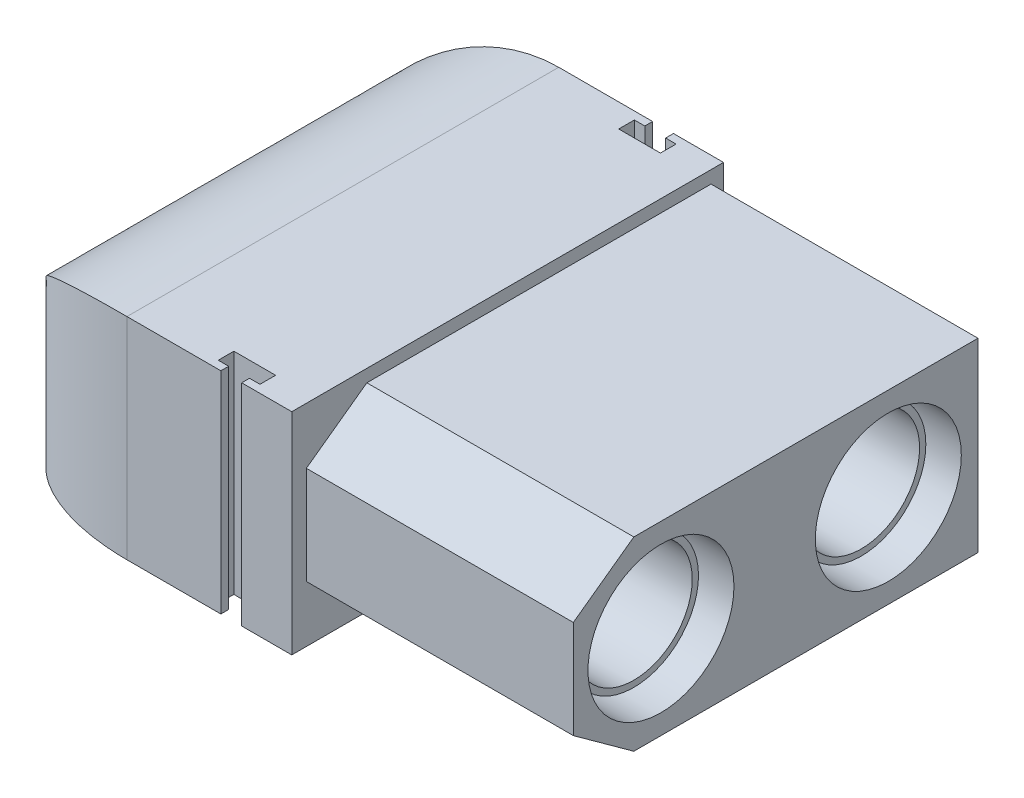
from build123d import *

# Parameters (mm, degrees)
SKETCH1_W           = 6.5
SKETCH1_H           = 20.7
BOSS_EXTRUDE1_DEPTH = 10.1
FILLET1_SIZE        = 4
FILLET1_SIZE_2      = 6.5
FILLET2_SIZE        = 3.5
FILLET2_SIZE_2      = 6.5
SKETCH4_R           = 1.75
BOSS_EXTRUDE3_DEPTH = 2.7
FILLET4_R           = 0.15
SKETCH2_W           = 20.7
SKETCH2_H           = 10.1
CUT_EXTRUDE1_DEPTH  = 12.8
SKETCH5_R           = 3.5
CUT_EXTRUDE2_DEPTH  = 13.3
SKETCH6_R           = 3.1
SKETCH6_R_2         = 2.8
BOSS_EXTRUDE4_DEPTH = 12


with BuildPart() as part:
    # Sketch1 → Boss-Extrude1 (new body)
    with BuildSketch(Plane(origin=(0, 0, 0), x_dir=(1, 0, 0), z_dir=(0, 1, 0))):
        Polygon((-2.6, 10.35), (-7.1, 10.35), (-7.1, -10.35), (-2.6, -10.35), (-2.6, -9.975), (-3.1, -9.975), (-3.1, -9.225), (-1.1, -9.225), (-1.1, -9.975), (-1.6, -9.975), (-1.6, -10.35), (13.6, -10.35), (13.6, 10.35), (-1.6, 10.35), (-1.6, 9.975), (-1.1, 9.975), (-1.1, 9.225), (-3.1, 9.225), (-3.1, 9.975), (-2.6, 9.975), align=None)
        with Locations((-10.35, 0)):
            Rectangle(SKETCH1_W, SKETCH1_H)
    extrude(amount=BOSS_EXTRUDE1_DEPTH)

    # Fillet1
    # a fillet whose section is not a circle: 6.5, 4 mm, written as the material it takes off along each edge
    with BuildSketch(Plane(origin=(-13.6, 10.1, -26.6), x_dir=(0, -1, 0), z_dir=(0, 0, 1))) as fillet1_piece_1:
        with BuildLine():
            Bezier((FILLET1_SIZE, 0), (0, 0), (0, FILLET1_SIZE_2), weights=[1, 0.707106781, 1])
            Line((0, FILLET1_SIZE_2), (0, 0))
            Line((0, 0), (FILLET1_SIZE, 0))
        make_face()
    extrude(amount=53.2, mode=Mode.SUBTRACT)

    # Fillet2
    # a fillet whose section is not a circle: 6.5, 3.5 mm, written as the material it takes off along each edge
    with BuildSketch(Plane(origin=(-13.6, -16.25, 10.35), x_dir=(0, 0, -1), z_dir=(0, 1, 0))) as fillet2_piece_1:
        with BuildLine():
            Bezier((FILLET2_SIZE, 0), (0, 0), (0, -FILLET2_SIZE_2), weights=[1, 0.707106781, 1])
            Line((0, -FILLET2_SIZE_2), (0, 0))
            Line((0, 0), (FILLET2_SIZE, 0))
        make_face()
    extrude(amount=38.6, mode=Mode.SUBTRACT)
    with BuildSketch(Plane(origin=(-13.6, -16.25, -10.35), x_dir=(1, 0, 0), z_dir=(0, 1, 0))) as fillet2_piece_2:
        with BuildLine():
            Bezier((FILLET2_SIZE_2, 0), (0, 0), (0, -FILLET2_SIZE), weights=[1, 0.707106781, 1])
            Line((0, -FILLET2_SIZE), (0, 0))
            Line((0, 0), (FILLET2_SIZE_2, 0))
        make_face()
    extrude(amount=38.6, mode=Mode.SUBTRACT)

    # Sketch4 → Boss-Extrude3 (add)
    with BuildSketch(Plane.XZ):
        with Locations(Location((-11.1, -5.65, 0), (0, 0, 90))):
            Circle(SKETCH4_R)
        with Locations(Location((-11.1, 5.65, 0), (0, 0, 90))):
            Circle(SKETCH4_R)
    extrude(amount=BOSS_EXTRUDE3_DEPTH)

    # Fillet4
    fillet4_edges = [part.edges().sort_by_distance(p)[0] for p in [
        (-11.1, -2.7, -7.4),
        (-11.1, -2.7, 3.9),
    ]]
    fillet(fillet4_edges, radius=FILLET4_R)

    # Sketch2 → Cut-Extrude1 (cut)
    with BuildSketch(Plane(origin=(13.6, 0, 0), x_dir=(0, 0, -1), z_dir=(1, 0, 0))):
        with Locations((0, 5.05)):
            Rectangle(SKETCH2_W, SKETCH2_H)
        Polygon((-9.65, 7.4), (-9.65, 2.7), (-6.75, 0.6), (6.85, 0.6), (9.75, 0.6), (9.75, 9.5), (6.85, 9.5), (-6.75, 9.5), align=None, mode=Mode.SUBTRACT)
    extrude(amount=-CUT_EXTRUDE1_DEPTH, mode=Mode.SUBTRACT)

    # Sketch5 → Cut-Extrude2 (cut)
    with BuildSketch(Plane(origin=(13.6, 0, 0), x_dir=(0, 0, -1), z_dir=(1, 0, 0))):
        with Locations((-5.45, 5.05)):
            Circle(SKETCH5_R)
        with Locations((5.45, 5.05)):
            Circle(SKETCH5_R)
    extrude(amount=-CUT_EXTRUDE2_DEPTH, mode=Mode.SUBTRACT)

    # Sketch6 → Boss-Extrude4 (add)
    # profile 1 of 2: a face of its own
    with BuildSketch(Plane(origin=(0.3, 0, 0), x_dir=(0, 0, -1), z_dir=(1, 0, 0))):
        with Locations((-5.45, 5.05)):
            Circle(SKETCH6_R)
        with Locations((-5.45, 5.05)):
            Circle(SKETCH6_R_2, mode=Mode.SUBTRACT)
    # profile 2 of 2: a face of its own
    with BuildSketch(Plane(origin=(0.3, 0, 0), x_dir=(0, 0, -1), z_dir=(1, 0, 0))):
        with Locations((5.45, 5.05)):
            Circle(SKETCH6_R)
        with Locations((5.45, 5.05)):
            Circle(SKETCH6_R_2, mode=Mode.SUBTRACT)
    extrude(amount=BOSS_EXTRUDE4_DEPTH)


solid = part.part
